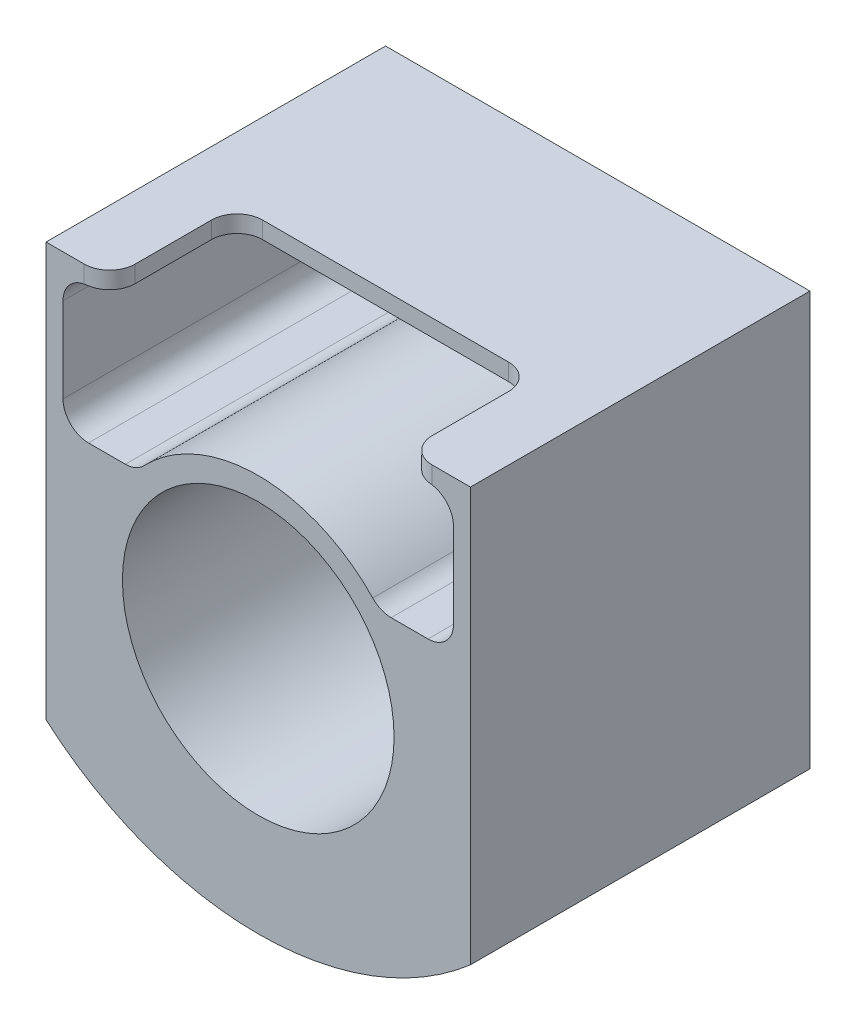
from build123d import *

# Parameters (mm, degrees)
BOSS_EXTRUDE2_DEPTH     = 40
CUT_EXTRUDE1_DEPTH      = 61.635055867
CUT_EXTRUDE1_DEPTH_BACK = 61.635055867
SKETCH2_R               = 16
CUT_EXTRUDE3_DEPTH      = 61.635055867
FILLET1_R               = 3
SKETCH5_W               = 35
SKETCH5_H               = 15
CUT_EXTRUDE4_DEPTH      = 10
FILLET2_R               = 3


with BuildPart() as part:
    # Sketch1 → Boss-Extrude2 (new body)
    with BuildSketch(Plane.XY):
        with BuildLine():
            Line((-25, 0), (-25, -28.750826075))
            ThreePointArc((-25, -28.750826075), (0, -38.1), (25, -28.750826075))
            Line((25, -28.750826075), (25, 0))
            Line((25, 0), (25, 20))
            Line((25, 20), (-25, 20))
            Line((-25, 20), (-25, 0))
        make_face()
    extrude(amount=BOSS_EXTRUDE2_DEPTH)

    # Sketch2 → Cut-Extrude1 (cut, two sides: drawn at the far end of the back side and taken through both)
    with BuildSketch(Plane.XY.offset(40).offset(-CUT_EXTRUDE1_DEPTH_BACK)):
        with Locations((0, -10)):
            Circle(SKETCH2_R)
    extrude(amount=CUT_EXTRUDE1_DEPTH + CUT_EXTRUDE1_DEPTH_BACK, mode=Mode.SUBTRACT)

    # Sketch4 → Cut-Extrude3 (cut, through all)
    with BuildSketch(Plane.XY.offset(40)):
        with BuildLine():
            Line((-23, 18), (23, 18))
            Line((23, 18), (23, 2))
            Line((23, 2), (14.317821063, 2))
            ThreePointArc((14.317821063, 2), (0, 8.681541692), (-14.317821063, 2))
            Line((-14.317821063, 2), (-23, 2))
            Line((-23, 2), (-23, 18))
        make_face()
    extrude(amount=-CUT_EXTRUDE3_DEPTH, mode=Mode.SUBTRACT)

    # Fillet1
    fillet1_edges = [part.edges().sort_by_distance(p)[0] for p in [
        (23, 18, 20),
        (23, 2, 20),
        (14.317821063, 2, 20),
        (-14.317821063, 2, 20),
        (-23, 2, 20),
        (-23, 18, 20),
    ]]
    fillet(fillet1_edges, radius=FILLET1_R)

    # Sketch5 → Cut-Extrude4 (cut)
    with BuildSketch(Plane(origin=(0, 20, 0), x_dir=(1, 0, 0), z_dir=(0, 1, 0))):
        with Locations((0, -32.5)):
            Rectangle(SKETCH5_W, SKETCH5_H)
    extrude(amount=-CUT_EXTRUDE4_DEPTH, mode=Mode.SUBTRACT)

    # Fillet2
    fillet2_edges = [part.edges().sort_by_distance(p)[0] for p in [
        (17.5, 19, 40),
        (17.5, 19, 25),
        (-17.5, 19, 25),
        (-17.5, 19, 40),
    ]]
    fillet(fillet2_edges, radius=FILLET2_R)


solid = part.part
